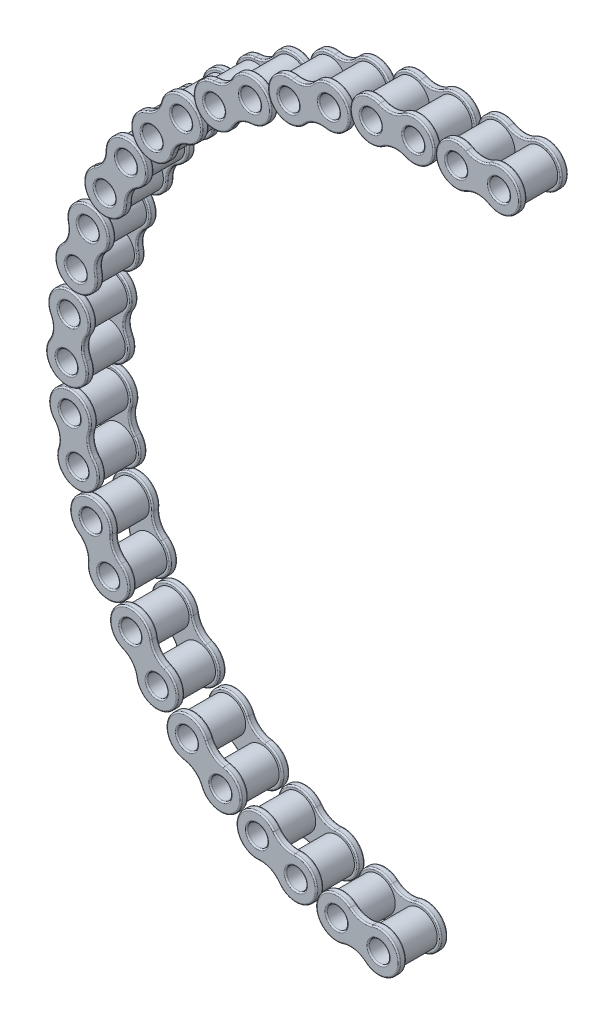
from build123d import *

# Parameters (mm, degrees)
ESQUISSE1_R                = 1.25
ESQUISSE1_R_2              = 0.75
BOSS_EXTRU_2_DEPTH         = 3.5
BOSS_EXTRU_2_2_DEPTH       = 3.5
BOSS_EXTRU_5_START         = -0.5
ESQUISSE2_R                = 1.25
BOSS_EXTRU_5_DEPTH         = 0.5
CONG_2_R                   = 0.1
CONG_3_R                   = 0.1
CONG_4_R                   = 0.1
CONG_5_R                   = 0.1
R_P_T_PAR_COURBE5_ANGLE    = 168.6586365
R_P_T_PAR_COURBE5_2_ANGLE  = 155.0871434
R_P_T_PAR_COURBE5_3_ANGLE  = 141.5156503
R_P_T_PAR_COURBE5_4_ANGLE  = 127.9441571
R_P_T_PAR_COURBE5_5_ANGLE  = 114.372664
R_P_T_PAR_COURBE5_6_ANGLE  = 100.8011708
R_P_T_PAR_COURBE5_7_ANGLE  = 87.2296777
R_P_T_PAR_COURBE5_8_ANGLE  = 73.6581846
R_P_T_PAR_COURBE5_9_ANGLE  = 60.0866914
R_P_T_PAR_COURBE5_10_ANGLE = 46.5151983
R_P_T_PAR_COURBE5_11_ANGLE = 32.9437051
R_P_T_PAR_COURBE5_12_ANGLE = 19.372212
R_P_T_PAR_COURBE5_13_ANGLE = 5.8007188


with BuildPart() as part:
    # Esquisse1 → Boss.-Extru.2 (new body)
    with BuildSketch(Plane.XY):
        with Locations((-1.55, -0.263151096)):
            Circle(ESQUISSE1_R)
        with Locations((-1.55, -0.263151096)):
            Circle(ESQUISSE1_R_2, mode=Mode.SUBTRACT)
    extrude(amount=BOSS_EXTRU_2_DEPTH)



with BuildPart() as body_2:
    # Esquisse1 → Boss.-Extru.2 2 (new body)
    with BuildSketch(Plane.XY):
        with Locations((1.55, -0.263151096)):
            Circle(ESQUISSE1_R)
        with Locations((1.55, -0.263151096)):
            Circle(ESQUISSE1_R_2, mode=Mode.SUBTRACT)
    extrude(amount=BOSS_EXTRU_2_2_DEPTH)


with BuildPart() as part_1:
    add(part.part)

    add(body_2.part)  # Boss.-Extru.5 merges body 2
    # Esquisse2 → Boss.-Extru.5 (add)
    with BuildSketch(Plane.XY.offset(3.5).offset(BOSS_EXTRU_5_START)):
        with BuildLine():
            ThreePointArc((-0.808658926, 1.040847911), (-3.05, -0.263151096), (-0.808658926, -1.567150104))
            ThreePointArc((-0.808658926, -1.567150104), (0, -1.353351142), (0.808658926, -1.567150104))
            ThreePointArc((0.808658926, -1.567150104), (3.05, -0.263151096), (0.808658926, 1.040847911))
            ThreePointArc((0.808658926, 1.040847911), (0, 0.82704895), (-0.808658926, 1.040847911))
        make_face()
        with Locations((-1.55, -0.263151096)):
            Circle(ESQUISSE2_R, mode=Mode.SUBTRACT)
        with Locations((1.55, -0.263151096)):
            Circle(ESQUISSE2_R, mode=Mode.SUBTRACT)
    boss_extru_5 = extrude(amount=BOSS_EXTRU_5_DEPTH)

    # Congé2
    cong_2_edges = [part_1.edges().sort_by_distance(p)[0] for p in [
        (0.8, -0.263151096, 3.5),
        (-2.3, -0.263151096, 3.5),
    ]]
    fillet(cong_2_edges, radius=CONG_2_R)

    # Congé3
    cong_3_edges = [part_1.edges().sort_by_distance(p)[0] for p in [
        (0, -1.353351142, 3.5),
        (-3.05, -0.263151096, 3.5),
        (3.05, -0.263151096, 3.5),
        (0, 0.82704895, 3.5),
    ]]
    fillet(cong_3_edges, radius=CONG_3_R)

    # Congé4
    cong_4_edges = [part_1.edges().sort_by_distance(p)[0] for p in [
        (3.05, -0.263151096, 3),
        (0, -1.353351142, 3),
        (-3.05, -0.263151096, 3),
        (0, 0.82704895, 3),
    ]]
    fillet(cong_4_edges, radius=CONG_4_R)

    # Symétrie2: Boss.-Extru.5 across plane
    add(boss_extru_5.mirror(Plane.XY.offset(1.75)))

    # Congé5
    cong_5_edges = [part_1.edges().sort_by_distance(p)[0] for p in [
        (0.8, -0.263151096, 0),
        (-2.3, -0.263151096, 0),
        (-3.05, -0.263151096, 0),
        (0, -1.353351142, 0.5),
        (3.05, -0.263151096, 0),
        (0, 0.82704895, 0),
        (-3.05, -0.263151096, 0.5),
        (3.05, -0.263151096, 0.5),
        (0, 0.82704895, 0.5),
        (0, -1.353351142, 0),
    ]]
    fillet(cong_5_edges, radius=CONG_5_R)


with BuildPart() as body_2_2:
    # Répét. par courbe5: read off the stored shape, not the designer's step
    # Répét. par courbe5: copy of part
    add(part_1.part.moved(Location((-1.7184899, 53.0581647, 0))).rotate(Axis((0, 0, 0), (0, 0, 1)), R_P_T_PAR_COURBE5_ANGLE))


with BuildPart() as body_3:
    # R_p_t. par courbe5 2: copy of part
    add(part_1.part.moved(Location((-7.9171184, 51.9116191, 0))).rotate(Axis((0, 0, 0), (0, 0, 1)), R_P_T_PAR_COURBE5_2_ANGLE))


with BuildPart() as body_4:
    # R_p_t. par courbe5 3: copy of part
    add(part_1.part.moved(Location((-13.6736213, 49.3425265, 0))).rotate(Axis((0, 0, 0), (0, 0, 1)), R_P_T_PAR_COURBE5_3_ANGLE))


with BuildPart() as body_5:
    # R_p_t. par courbe5 4: copy of part
    add(part_1.part.moved(Location((-18.666531, 45.4943562, 0))).rotate(Axis((0, 0, 0), (0, 0, 1)), R_P_T_PAR_COURBE5_4_ANGLE))


with BuildPart() as body_6:
    # R_p_t. par courbe5 5: copy of part
    add(part_1.part.moved(Location((-22.6170222, 40.5820064, 0))).rotate(Axis((0, 0, 0), (0, 0, 1)), R_P_T_PAR_COURBE5_5_ANGLE))


with BuildPart() as body_7:
    # R_p_t. par courbe5 6: copy of part
    add(part_1.part.moved(Location((-25.3044826, 34.8798034, 0))).rotate(Axis((0, 0, 0), (0, 0, 1)), R_P_T_PAR_COURBE5_6_ANGLE))


with BuildPart() as body_8:
    # R_p_t. par courbe5 7: copy of part
    add(part_1.part.moved(Location((-26.578833, 28.7061827, 0))).rotate(Axis((0, 0, 0), (0, 0, 1)), R_P_T_PAR_COURBE5_7_ANGLE))


with BuildPart() as body_9:
    # R_p_t. par courbe5 8: copy of part
    add(part_1.part.moved(Location((-26.3689084, 22.4059055, 0))).rotate(Axis((0, 0, 0), (0, 0, 1)), R_P_T_PAR_COURBE5_8_ANGLE))


with BuildPart() as body_10:
    # R_p_t. par courbe5 9: copy of part
    add(part_1.part.moved(Location((-24.6864317, 16.330806, 0))).rotate(Axis((0, 0, 0), (0, 0, 1)), R_P_T_PAR_COURBE5_9_ANGLE))


with BuildPart() as body_11:
    # R_p_t. par courbe5 10: copy of part
    add(part_1.part.moved(Location((-21.6253596, 10.8201436, 0))).rotate(Axis((0, 0, 0), (0, 0, 1)), R_P_T_PAR_COURBE5_10_ANGLE))


with BuildPart() as body_12:
    # R_p_t. par courbe5 11: copy of part
    add(part_1.part.moved(Location((-17.3566354, 6.1816573, 0))).rotate(Axis((0, 0, 0), (0, 0, 1)), R_P_T_PAR_COURBE5_11_ANGLE))


with BuildPart() as body_13:
    # R_p_t. par courbe5 12: copy of part
    add(part_1.part.moved(Location((-12.1186428, 2.6743797, 0))).rotate(Axis((0, 0, 0), (0, 0, 1)), R_P_T_PAR_COURBE5_12_ANGLE))


with BuildPart() as body_14:
    # R_p_t. par courbe5 13: copy of part
    add(part_1.part.moved(Location((-6.2038937, 0.4941723, 0))).rotate(Axis((0, 0, 0), (0, 0, 1)), R_P_T_PAR_COURBE5_13_ANGLE))


solid = Compound([part_1.part, body_2_2.part, body_3.part, body_4.part, body_5.part, body_6.part, body_7.part, body_8.part, body_9.part, body_10.part, body_11.part, body_12.part, body_13.part, body_14.part])
